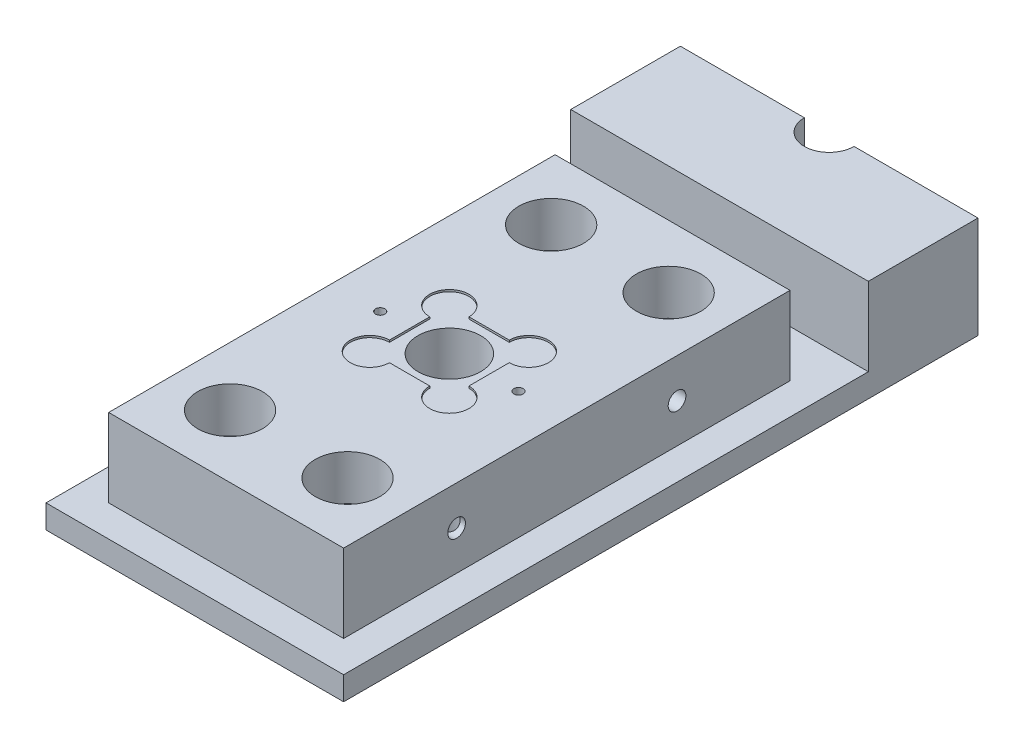
from build123d import *

# Parameters (mm, degrees)
MAIN_BODY_SKETCH_W                      = 30
MAIN_BODY_SKETCH_H                      = 57
MAIN_BODY_SKETCH_R                      = 4
MAIN_BODY_DEPTH                         = 10
STANDOFF_CUTOUTS_START                  = 4.25
STANDOFF_CUTOUTS_OUTLINE_R              = 4.125
STANDOFF_CUTOUTS_DEPTH                  = 5.75
F_4_40_TAPPED_HOLE_STANDOFF_D           = 2.2606
F_4_40_TAPPED_HOLE_STANDOFF_DEPTH       = 7.6
F_4_40_TAPPED_HOLE_STANDOFF_TIP         = 0.679152758
F_4_40_TAPPED_HOLE_HEAT_CART_AT_2_COUNT = 2
F_4_40_TAPPED_HOLE_HEAT_CART_AT_2_PITCH = 28.1443537
MAIN_BODY_SKETCH_7_W                    = 38
MAIN_BODY_SKETCH_7_H                    = 81
MAIN_BODY_SKETCH_7_W_2                  = 30
MAIN_BODY_SKETCH_7_H_2                  = 57
MAIN_BODY_SKETCH_7_H_3                  = 18.5
MAIN_BODY_SKETCH_7_R                    = 4.125
MAIN_BODY_SKETCH_7_H_4                  = 20
MAIN_BODY_SKETCH_7_R_2                  = 4
MAIN_BODY_SKETCH_7_H_5                  = 14
BASE_PLATE_DEPTH                        = 3
MAIN_BODY_SKETCH_8_W                    = 38
MAIN_BODY_SKETCH_8_H                    = 14
BASE_2_HOLE_CLAMP_POST_DEPTH            = 10
SKETCH12_W                              = 0.889
SKETCH12_H                              = 3
F_2_56_TAPPED_HOLE1_AT_2_COUNT          = 2
F_2_56_TAPPED_HOLE1_AT_2_PITCH          = 7.62
F_2_56_TAPPED_HOLE1_AT_3_COUNT          = 2
F_2_56_TAPPED_HOLE1_AT_3_PITCH          = 10.776307345
F_2_56_TAPPED_HOLE1_AT_4_COUNT          = 2
F_2_56_TAPPED_HOLE1_AT_4_PITCH          = 7.62
ROD_DIM_SKETCH_R                        = 3.175
COLD_ROD_CUT_DEPTH                      = 13
F_4_40_TAPPED_HOLE3_AT_2_COUNT          = 2
F_4_40_TAPPED_HOLE3_AT_2_PITCH          = 12.7
CHIP_SOCKET_START                       = -0.25
CHIP_POCKET_SKETCH_R                    = 2.5
CHIP_POCKET_SKETCH_W                    = 10.15
CHIP_POCKET_SKETCH_H                    = 10.15
CHIP_POCKET_SKETCH_R_2                  = 4
CHIP_SOCKET_DEPTH                       = 0.25
M4X0_7_TAPPED_HOLE2_AT_2_COUNT          = 2
M4X0_7_TAPPED_HOLE2_AT_2_PITCH          = 25.4
M4X0_7_TAPPED_HOLE2_AT_3_COUNT          = 2
M4X0_7_TAPPED_HOLE2_AT_3_PITCH          = 35.921024484
M4X0_7_TAPPED_HOLE2_AT_4_COUNT          = 2
M4X0_7_TAPPED_HOLE2_AT_4_PITCH          = 25.4
F_0_80_TAPPED_HOLE1_AT_2_COUNT          = 2
F_0_80_TAPPED_HOLE1_AT_2_PITCH          = 17.653703617


# Read off the part's stored shape, not the designer's step: Standoff_Cutouts
with BuildPart() as part:
    # Main_Body_Sketch → Main_Body (new body)
    with BuildSketch(Plane(origin=(0, 0, 0), x_dir=(1, 0, 0), z_dir=(0, 1, 0))):
        with Locations((15, -28.5)):
            Rectangle(MAIN_BODY_SKETCH_W, MAIN_BODY_SKETCH_H)
        with Locations(Location((15, -28.5, 0), (0, 0, 270))):
            Circle(MAIN_BODY_SKETCH_R, mode=Mode.SUBTRACT)
    extrude(amount=MAIN_BODY_DEPTH)

    # Standoff_Cutouts outline → Standoff_Cutouts (cut)
    with BuildSketch(Plane(origin=(0, 0, 0), x_dir=(1, 0, 0), z_dir=(0, 1, 0)).offset(STANDOFF_CUTOUTS_START)):
        with Locations((7.5, -49)):
            Circle(STANDOFF_CUTOUTS_OUTLINE_R)
        with Locations((22.5, -8)):
            Circle(STANDOFF_CUTOUTS_OUTLINE_R)
        with Locations((7.5, -8)):
            Circle(STANDOFF_CUTOUTS_OUTLINE_R)
        with Locations((22.5, -49)):
            Circle(STANDOFF_CUTOUTS_OUTLINE_R)
    extrude(amount=STANDOFF_CUTOUTS_DEPTH, mode=Mode.SUBTRACT)

    # #4-40 Tapped Hole_Standoff
    with Locations(Plane(origin=(7.5, 10, 8), x_dir=(0, 0, 1), z_dir=(0, 1, 0))):
        with Locations((0, 0), (0, 15), (41, 0), (41, 15)):
            Hole(F_4_40_TAPPED_HOLE_STANDOFF_D / 2, depth=F_4_40_TAPPED_HOLE_STANDOFF_DEPTH)
            with Locations((0, 0, -(F_4_40_TAPPED_HOLE_STANDOFF_DEPTH + F_4_40_TAPPED_HOLE_STANDOFF_TIP / 2))):  # 118° drill point
                Cone(0, F_4_40_TAPPED_HOLE_STANDOFF_D / 2, F_4_40_TAPPED_HOLE_STANDOFF_TIP, mode=Mode.SUBTRACT)

    # Sketch6 → #4-40 Tapped Hole_Heat_Cart (revolve, cut)
    with BuildSketch(Plane(origin=(30, 5, 42.57217685), x_dir=(0, 0, -1), z_dir=(0, 1, 0))):
        Polygon((0, 0), (0, 8.279152758), (1.1303, 7.6), (1.1303, 0), align=None)
    f_4_40_tapped_hole_heat_cart = revolve(axis=Axis((36.35, 5, 42.57217685), (-1, 0, 0)), mode=Mode.SUBTRACT)

    # #4-40 Tapped Hole_Heat_Cart at 2: #4-40 Tapped Hole_Heat_Cart ×2
    with Locations(*[(0, 0, -i * F_4_40_TAPPED_HOLE_HEAT_CART_AT_2_PITCH) for i in range(1, F_4_40_TAPPED_HOLE_HEAT_CART_AT_2_COUNT)]):
        add(f_4_40_tapped_hole_heat_cart, mode=Mode.SUBTRACT)

    # Heat_Cart_mirror_holes: #4-40 Tapped Hole_Heat_Cart across plane
    add(f_4_40_tapped_hole_heat_cart.mirror(Plane.ZY.offset(-15)), mode=Mode.SUBTRACT)

    # Heat_Cart_mirror_holes copy 1 sketch → Heat_Cart_mirror_holes copy 1 (revolve, cut)
    with BuildSketch(Plane(origin=(0, 5, 14.42782315), x_dir=(0, 0, -1), z_dir=(0, 1, 0))):
        Polygon((0, 0), (0, -8.279152758), (1.1303, -7.6), (1.1303, 0), align=None)
    revolve(axis=Axis((-6.35, 5, 14.42782315), (-1, 0, 0)), mode=Mode.SUBTRACT)

    # Hole Thread16: #4-40 Tapped Hole_Heat_Cart across Right Plane
    add(f_4_40_tapped_hole_heat_cart.mirror(Plane(origin=(0, 0, 0), x_dir=(0, 0, -1), z_dir=(1, 0, 0))), mode=Mode.SUBTRACT)

    # Chip_Pocket_sketch → Chip_socket (cut)
    # profile 1 of 21: a face of its own
    with BuildSketch(Plane(origin=(0, 10, 0), x_dir=(1, 0, 0), z_dir=(0, 1, 0)).offset(CHIP_SOCKET_START)):
        with BuildLine():
            ThreePointArc((22.575, -23.425), (20.075, -20.925), (17.575, -23.425))
            Line((17.575, -23.425), (20.075, -23.425))
            Line((20.075, -23.425), (20.075, -25.925))
            ThreePointArc((20.075, -25.925), (21.842766953, -25.192766953), (22.575, -23.425))
        make_face()
    # profile 2 of 21: a face of its own
    with BuildSketch(Plane(origin=(0, 10, 0), x_dir=(1, 0, 0), z_dir=(0, 1, 0)).offset(CHIP_SOCKET_START)):
        with BuildLine():
            Line((20.075, -23.425), (17.575, -23.425))
            ThreePointArc((17.575, -23.425), (18.307233047, -25.192766953), (20.075, -25.925))
            Line((20.075, -25.925), (20.075, -23.425))
        make_face()
    # profile 3 of 21: a face of its own
    with BuildSketch(Plane(origin=(0, 10, 0), x_dir=(1, 0, 0), z_dir=(0, 1, 0)).offset(CHIP_SOCKET_START)):
        with BuildLine():
            ThreePointArc((22.575, -23.425), (20.075, -20.925), (17.575, -23.425))
            Line((17.575, -23.425), (20.075, -23.425))
            Line((20.075, -23.425), (20.075, -25.925))
            ThreePointArc((20.075, -25.925), (21.842766953, -25.192766953), (22.575, -23.425))
        make_face()
    # profile 4 of 21: a face of its own
    with BuildSketch(Plane(origin=(0, 10, 0), x_dir=(1, 0, 0), z_dir=(0, 1, 0)).offset(CHIP_SOCKET_START)):
        with BuildLine():
            Line((20.075, -23.425), (17.575, -23.425))
            ThreePointArc((17.575, -23.425), (18.307233047, -25.192766953), (20.075, -25.925))
            Line((20.075, -25.925), (20.075, -23.425))
        make_face()
    # profile 5 of 21: a face of its own
    with BuildSketch(Plane(origin=(0, 10, 0), x_dir=(1, 0, 0), z_dir=(0, 1, 0)).offset(CHIP_SOCKET_START)):
        with Locations((20.075, -33.575)):
            Circle(CHIP_POCKET_SKETCH_R)
    # profile 6 of 21: a face of its own
    with BuildSketch(Plane(origin=(0, 10, 0), x_dir=(1, 0, 0), z_dir=(0, 1, 0)).offset(CHIP_SOCKET_START)):
        with Locations((20.075, -23.425)):
            Circle(CHIP_POCKET_SKETCH_R)
    # profile 7 of 21: a face of its own
    with BuildSketch(Plane(origin=(0, 10, 0), x_dir=(1, 0, 0), z_dir=(0, 1, 0)).offset(CHIP_SOCKET_START)):
        with Locations((9.925, -23.425)):
            Circle(CHIP_POCKET_SKETCH_R)
    # profile 8 of 21: a face of its own
    with BuildSketch(Plane(origin=(0, 10, 0), x_dir=(1, 0, 0), z_dir=(0, 1, 0)).offset(CHIP_SOCKET_START)):
        with Locations((9.925, -33.575)):
            Circle(CHIP_POCKET_SKETCH_R)
    # profile 9 of 21: a face of its own
    with BuildSketch(Plane(origin=(0, 10, 0), x_dir=(1, 0, 0), z_dir=(0, 1, 0)).offset(CHIP_SOCKET_START)):
        with Locations((15, -28.5)):
            Rectangle(CHIP_POCKET_SKETCH_W, CHIP_POCKET_SKETCH_H)
        with Locations(Location((15, -28.5, 0), (0, 0, 270))):
            Circle(CHIP_POCKET_SKETCH_R_2, mode=Mode.SUBTRACT)
    # profile 10 of 21: a face of its own
    with BuildSketch(Plane(origin=(0, 10, 0), x_dir=(1, 0, 0), z_dir=(0, 1, 0)).offset(CHIP_SOCKET_START)):
        with BuildLine():
            ThreePointArc((20.075, -31.075), (18.307233047, -31.807233047), (17.575, -33.575))
            Line((17.575, -33.575), (20.075, -33.575))
            Line((20.075, -33.575), (20.075, -31.075))
        make_face()
    # profile 11 of 21: a face of its own
    with BuildSketch(Plane(origin=(0, 10, 0), x_dir=(1, 0, 0), z_dir=(0, 1, 0)).offset(CHIP_SOCKET_START)):
        with BuildLine():
            Line((20.075, -33.575), (17.575, -33.575))
            ThreePointArc((17.575, -33.575), (20.075, -36.075), (22.575, -33.575))
            ThreePointArc((22.575, -33.575), (21.842766953, -31.807233047), (20.075, -31.075))
            Line((20.075, -31.075), (20.075, -33.575))
        make_face()
    # profile 12 of 21: a face of its own
    with BuildSketch(Plane(origin=(0, 10, 0), x_dir=(1, 0, 0), z_dir=(0, 1, 0)).offset(CHIP_SOCKET_START)):
        with BuildLine():
            ThreePointArc((20.075, -31.075), (18.307233047, -31.807233047), (17.575, -33.575))
            Line((17.575, -33.575), (20.075, -33.575))
            Line((20.075, -33.575), (20.075, -31.075))
        make_face()
    # profile 13 of 21: a face of its own
    with BuildSketch(Plane(origin=(0, 10, 0), x_dir=(1, 0, 0), z_dir=(0, 1, 0)).offset(CHIP_SOCKET_START)):
        with BuildLine():
            Line((20.075, -33.575), (17.575, -33.575))
            ThreePointArc((17.575, -33.575), (20.075, -36.075), (22.575, -33.575))
            ThreePointArc((22.575, -33.575), (21.842766953, -31.807233047), (20.075, -31.075))
            Line((20.075, -31.075), (20.075, -33.575))
        make_face()
    # profile 14 of 21: a face of its own
    with BuildSketch(Plane(origin=(0, 10, 0), x_dir=(1, 0, 0), z_dir=(0, 1, 0)).offset(CHIP_SOCKET_START)):
        with BuildLine():
            ThreePointArc((12.425, -33.575), (11.692766953, -31.807233047), (9.925, -31.075))
            Line((9.925, -31.075), (9.925, -33.575))
            Line((9.925, -33.575), (12.425, -33.575))
        make_face()
    # profile 15 of 21: a face of its own
    with BuildSketch(Plane(origin=(0, 10, 0), x_dir=(1, 0, 0), z_dir=(0, 1, 0)).offset(CHIP_SOCKET_START)):
        with BuildLine():
            Line((9.925, -33.575), (9.925, -31.075))
            ThreePointArc((9.925, -31.075), (8.157233047, -35.342766953), (12.425, -33.575))
            Line((12.425, -33.575), (9.925, -33.575))
        make_face()
    # profile 16 of 21: a face of its own
    with BuildSketch(Plane(origin=(0, 10, 0), x_dir=(1, 0, 0), z_dir=(0, 1, 0)).offset(CHIP_SOCKET_START)):
        with BuildLine():
            ThreePointArc((12.425, -33.575), (11.692766953, -31.807233047), (9.925, -31.075))
            Line((9.925, -31.075), (9.925, -33.575))
            Line((9.925, -33.575), (12.425, -33.575))
        make_face()
    # profile 17 of 21: a face of its own
    with BuildSketch(Plane(origin=(0, 10, 0), x_dir=(1, 0, 0), z_dir=(0, 1, 0)).offset(CHIP_SOCKET_START)):
        with BuildLine():
            Line((9.925, -33.575), (9.925, -31.075))
            ThreePointArc((9.925, -31.075), (8.157233047, -35.342766953), (12.425, -33.575))
            Line((12.425, -33.575), (9.925, -33.575))
        make_face()
    # profile 18 of 21: a face of its own
    with BuildSketch(Plane(origin=(0, 10, 0), x_dir=(1, 0, 0), z_dir=(0, 1, 0)).offset(CHIP_SOCKET_START)):
        with BuildLine():
            Line((12.425, -23.425), (9.925, -23.425))
            Line((9.925, -23.425), (9.925, -25.925))
            ThreePointArc((9.925, -25.925), (11.692766953, -25.192766953), (12.425, -23.425))
        make_face()
    # profile 19 of 21: a face of its own
    with BuildSketch(Plane(origin=(0, 10, 0), x_dir=(1, 0, 0), z_dir=(0, 1, 0)).offset(CHIP_SOCKET_START)):
        with BuildLine():
            Line((9.925, -25.925), (9.925, -23.425))
            Line((9.925, -23.425), (12.425, -23.425))
            ThreePointArc((12.425, -23.425), (8.157233047, -21.657233047), (9.925, -25.925))
        make_face()
    # profile 20 of 21: a face of its own
    with BuildSketch(Plane(origin=(0, 10, 0), x_dir=(1, 0, 0), z_dir=(0, 1, 0)).offset(CHIP_SOCKET_START)):
        with BuildLine():
            Line((12.425, -23.425), (9.925, -23.425))
            Line((9.925, -23.425), (9.925, -25.925))
            ThreePointArc((9.925, -25.925), (11.692766953, -25.192766953), (12.425, -23.425))
        make_face()
    # profile 21 of 21: a face of its own
    with BuildSketch(Plane(origin=(0, 10, 0), x_dir=(1, 0, 0), z_dir=(0, 1, 0)).offset(CHIP_SOCKET_START)):
        with BuildLine():
            Line((9.925, -25.925), (9.925, -23.425))
            Line((9.925, -23.425), (12.425, -23.425))
            ThreePointArc((12.425, -23.425), (8.157233047, -21.657233047), (9.925, -25.925))
        make_face()
    extrude(amount=CHIP_SOCKET_DEPTH, mode=Mode.SUBTRACT)


with BuildPart() as body_2:
    # Main_Body_Sketch<7> → Base_Plate (new body)
    # profile 1 of 9: a face of its own
    with BuildSketch(Plane(origin=(0, 0, 0), x_dir=(1, 0, 0), z_dir=(0, 1, 0))):
        with Locations((15, -20.5)):
            Rectangle(MAIN_BODY_SKETCH_7_W, MAIN_BODY_SKETCH_7_H)
        with Locations((15, -28.5)):
            Rectangle(MAIN_BODY_SKETCH_7_W_2, MAIN_BODY_SKETCH_7_H_2, mode=Mode.SUBTRACT)
    # profile 2 of 9: a face of its own
    with BuildSketch(Plane(origin=(0, 0, 0), x_dir=(1, 0, 0), z_dir=(0, 1, 0))):
        with Locations((15, -47.75)):
            Rectangle(MAIN_BODY_SKETCH_7_W_2, MAIN_BODY_SKETCH_7_H_3)
        with Locations(Location((7.5, -49, 0), (0, 0, 270))):
            Circle(MAIN_BODY_SKETCH_7_R, mode=Mode.SUBTRACT)
        with Locations(Location((22.5, -49, 0), (0, 0, 270))):
            Circle(MAIN_BODY_SKETCH_7_R, mode=Mode.SUBTRACT)
    # profile 3 of 9: a face of its own
    with BuildSketch(Plane(origin=(0, 0, 0), x_dir=(1, 0, 0), z_dir=(0, 1, 0))):
        with Locations((15, -28.5)):
            Rectangle(MAIN_BODY_SKETCH_7_W_2, MAIN_BODY_SKETCH_7_H_4)
        with Locations(Location((15, -28.5, 0), (0, 0, 270))):
            Circle(MAIN_BODY_SKETCH_7_R_2, mode=Mode.SUBTRACT)
    # profile 4 of 9: a face of its own
    with BuildSketch(Plane(origin=(0, 0, 0), x_dir=(1, 0, 0), z_dir=(0, 1, 0))):
        with Locations((15, -9.25)):
            Rectangle(MAIN_BODY_SKETCH_7_W_2, MAIN_BODY_SKETCH_7_H_3)
        with Locations(Location((7.5, -8, 0), (0, 0, 270))):
            Circle(MAIN_BODY_SKETCH_7_R, mode=Mode.SUBTRACT)
        with Locations(Location((22.5, -8, 0), (0, 0, 270))):
            Circle(MAIN_BODY_SKETCH_7_R, mode=Mode.SUBTRACT)
    # profile 5 of 9: a face of its own
    with BuildSketch(Plane(origin=(0, 0, 0), x_dir=(1, 0, 0), z_dir=(0, 1, 0))):
        with Locations(Location((22.5, -49, 0), (0, 0, 270))):
            Circle(MAIN_BODY_SKETCH_7_R)
    # profile 6 of 9: a face of its own
    with BuildSketch(Plane(origin=(0, 0, 0), x_dir=(1, 0, 0), z_dir=(0, 1, 0))):
        with Locations(Location((7.5, -49, 0), (0, 0, 270))):
            Circle(MAIN_BODY_SKETCH_7_R)
    # profile 7 of 9: a face of its own
    with BuildSketch(Plane(origin=(0, 0, 0), x_dir=(1, 0, 0), z_dir=(0, 1, 0))):
        with Locations(Location((22.5, -8, 0), (0, 0, 270))):
            Circle(MAIN_BODY_SKETCH_7_R)
    # profile 8 of 9: a face of its own
    with BuildSketch(Plane(origin=(0, 0, 0), x_dir=(1, 0, 0), z_dir=(0, 1, 0))):
        with Locations(Location((7.5, -8, 0), (0, 0, 270))):
            Circle(MAIN_BODY_SKETCH_7_R)
    # profile 9 of 9: a face of its own
    with BuildSketch(Plane(origin=(0, 0, 0), x_dir=(1, 0, 0), z_dir=(0, 1, 0))):
        with Locations((15, 13)):
            Rectangle(MAIN_BODY_SKETCH_7_W, MAIN_BODY_SKETCH_7_H_5)
    extrude(amount=-BASE_PLATE_DEPTH)

    # Main_Body_Sketch<8> → Base_2_Hole_clamp_Post (add)
    with BuildSketch(Plane(origin=(0, 0, 0), x_dir=(1, 0, 0), z_dir=(0, 1, 0))):
        with Locations((15, 13)):
            Rectangle(MAIN_BODY_SKETCH_8_W, MAIN_BODY_SKETCH_8_H)
    extrude(amount=BASE_2_HOLE_CLAMP_POST_DEPTH)

    # Sketch12 → #2-56 Tapped Hole1 (revolve, cut)
    with BuildSketch(Plane(origin=(11.19, 0, -15.31), x_dir=(0, 0, 1), z_dir=(1, 0, 0))):
        with Locations((0.4445, 1.5)):
            Rectangle(SKETCH12_W, SKETCH12_H)
    f_2_56_tapped_hole1 = revolve(axis=Axis((11.19, 6.35, -15.31), (0, -1, 0)), mode=Mode.SUBTRACT)

    # #2-56 Tapped Hole1 at 2: #2-56 Tapped Hole1 ×2
    with Locations(*[(i * F_2_56_TAPPED_HOLE1_AT_2_PITCH, 0, 0) for i in range(1, F_2_56_TAPPED_HOLE1_AT_2_COUNT)]):
        add(f_2_56_tapped_hole1, mode=Mode.SUBTRACT)

    # #2-56 Tapped Hole1 at 3: #2-56 Tapped Hole1 ×2
    with Locations(*[Vector(0.7071067811865477, 0, 0.7071067811865474) * (i * F_2_56_TAPPED_HOLE1_AT_3_PITCH) for i in range(1, F_2_56_TAPPED_HOLE1_AT_3_COUNT)]):
        add(f_2_56_tapped_hole1, mode=Mode.SUBTRACT)

    # #2-56 Tapped Hole1 at 4: #2-56 Tapped Hole1 ×2
    with Locations(*[(0, 0, i * F_2_56_TAPPED_HOLE1_AT_4_PITCH) for i in range(1, F_2_56_TAPPED_HOLE1_AT_4_COUNT)]):
        add(f_2_56_tapped_hole1, mode=Mode.SUBTRACT)

    # Rod_Dim_sketch → Cold_Rod_Cut (cut)
    with BuildSketch(Plane(origin=(0, 10, 0), x_dir=(1, 0, 0), z_dir=(0, 1, 0))):
        with Locations((15, 20)):
            Circle(ROD_DIM_SKETCH_R)
    extrude(amount=-COLD_ROD_CUT_DEPTH, mode=Mode.SUBTRACT)

    # Sketch17 → #4-40 Tapped Hole3 (revolve, cut)
    with BuildSketch(Plane(origin=(21.35, 3.5, -20), x_dir=(0, 1, 0), z_dir=(1, 0, 0))):
        Polygon((0, 0), (0, 8.279152758), (1.1303, 7.6), (1.1303, 0), align=None)
    f_4_40_tapped_hole3 = revolve(axis=Axis((21.35, 3.5, -26.35), (0, 0, 1)), mode=Mode.SUBTRACT)

    # #4-40 Tapped Hole3 at 2: #4-40 Tapped Hole3 ×2
    with Locations(*[(-i * F_4_40_TAPPED_HOLE3_AT_2_PITCH, 0, 0) for i in range(1, F_4_40_TAPPED_HOLE3_AT_2_COUNT)]):
        add(f_4_40_tapped_hole3, mode=Mode.SUBTRACT)


with BuildPart() as m4x0_7_tapped_hole2_tool:
    # Sketch20 → M4x0.7 Tapped Hole2 (revolve)
    with BuildSketch(Plane(origin=(2.3, -3, 41.2), x_dir=(0, 0, -1), z_dir=(1, 0, 0))):
        Polygon((0, 0), (0, 11.091420021), (1.65, 10.1), (1.65, 0), align=None)
    m4x0_7_tapped_hole2 = revolve(axis=Axis((2.3, -9.35, 41.2), (0, 1, 0)))


with BuildPart() as part_1:
    add(part.part)

    # M4x0.7 Tapped Hole2: cut by m4x0_7_tapped_hole2_tool
    add(m4x0_7_tapped_hole2_tool.part, mode=Mode.SUBTRACT)


with BuildPart() as body_2_1:
    add(body_2.part)

    # M4x0.7 Tapped Hole2: cut by m4x0_7_tapped_hole2_tool
    add(m4x0_7_tapped_hole2_tool.part, mode=Mode.SUBTRACT)


with BuildPart() as m4x0_7_tapped_hole2_at_2_tool:
    # M4x0.7 Tapped Hole2 at 2: M4x0.7 Tapped Hole2 ×2
    with Locations(*[(i * M4X0_7_TAPPED_HOLE2_AT_2_PITCH, 0, 0) for i in range(1, M4X0_7_TAPPED_HOLE2_AT_2_COUNT)]):
        add(m4x0_7_tapped_hole2)


with BuildPart() as part_2:
    add(part_1.part)

    # M4x0.7 Tapped Hole2 at 2: cut by m4x0_7_tapped_hole2_at_2_tool
    add(m4x0_7_tapped_hole2_at_2_tool.part, mode=Mode.SUBTRACT)


with BuildPart() as body_2_2:
    add(body_2_1.part)

    # M4x0.7 Tapped Hole2 at 2: cut by m4x0_7_tapped_hole2_at_2_tool
    add(m4x0_7_tapped_hole2_at_2_tool.part, mode=Mode.SUBTRACT)


with BuildPart() as m4x0_7_tapped_hole2_at_3_tool:
    # M4x0.7 Tapped Hole2 at 3: M4x0.7 Tapped Hole2 ×2
    with Locations(*[Vector(0.7071067811865476, 0, -0.7071067811865476) * (i * M4X0_7_TAPPED_HOLE2_AT_3_PITCH) for i in range(1, M4X0_7_TAPPED_HOLE2_AT_3_COUNT)]):
        add(m4x0_7_tapped_hole2)


with BuildPart() as part_3:
    add(part_2.part)

    # M4x0.7 Tapped Hole2 at 3: cut by m4x0_7_tapped_hole2_at_3_tool
    add(m4x0_7_tapped_hole2_at_3_tool.part, mode=Mode.SUBTRACT)


with BuildPart() as body_2_3:
    add(body_2_2.part)

    # M4x0.7 Tapped Hole2 at 3: cut by m4x0_7_tapped_hole2_at_3_tool
    add(m4x0_7_tapped_hole2_at_3_tool.part, mode=Mode.SUBTRACT)


with BuildPart() as m4x0_7_tapped_hole2_at_4_tool:
    # M4x0.7 Tapped Hole2 at 4: M4x0.7 Tapped Hole2 ×2
    with Locations(*[(0, 0, -i * M4X0_7_TAPPED_HOLE2_AT_4_PITCH) for i in range(1, M4X0_7_TAPPED_HOLE2_AT_4_COUNT)]):
        add(m4x0_7_tapped_hole2)


with BuildPart() as part_4:
    add(part_3.part)

    # M4x0.7 Tapped Hole2 at 4: cut by m4x0_7_tapped_hole2_at_4_tool
    add(m4x0_7_tapped_hole2_at_4_tool.part, mode=Mode.SUBTRACT)

    # Sketch22 → #0-80 Tapped Hole1 (revolve, cut)
    with BuildSketch(Plane(origin=(6.173148192, 10, 28.5), x_dir=(0, 0, 1), z_dir=(1, 0, 0))):
        Polygon((0, 0), (0, 4.357890611), (0.59563, 4), (0.59563, 0), align=None)
    f_0_80_tapped_hole1 = revolve(axis=Axis((6.173148192, 16.35, 28.5), (0, -1, 0)), mode=Mode.SUBTRACT)

    # #0-80 Tapped Hole1 at 2: #0-80 Tapped Hole1 ×2
    with Locations(*[(i * F_0_80_TAPPED_HOLE1_AT_2_PITCH, 0, 0) for i in range(1, F_0_80_TAPPED_HOLE1_AT_2_COUNT)]):
        add(f_0_80_tapped_hole1, mode=Mode.SUBTRACT)


with BuildPart() as body_2_4:
    add(body_2_3.part)

    # M4x0.7 Tapped Hole2 at 4: cut by m4x0_7_tapped_hole2_at_4_tool
    add(m4x0_7_tapped_hole2_at_4_tool.part, mode=Mode.SUBTRACT)


solid = Compound([part_4.part, body_2_4.part])
